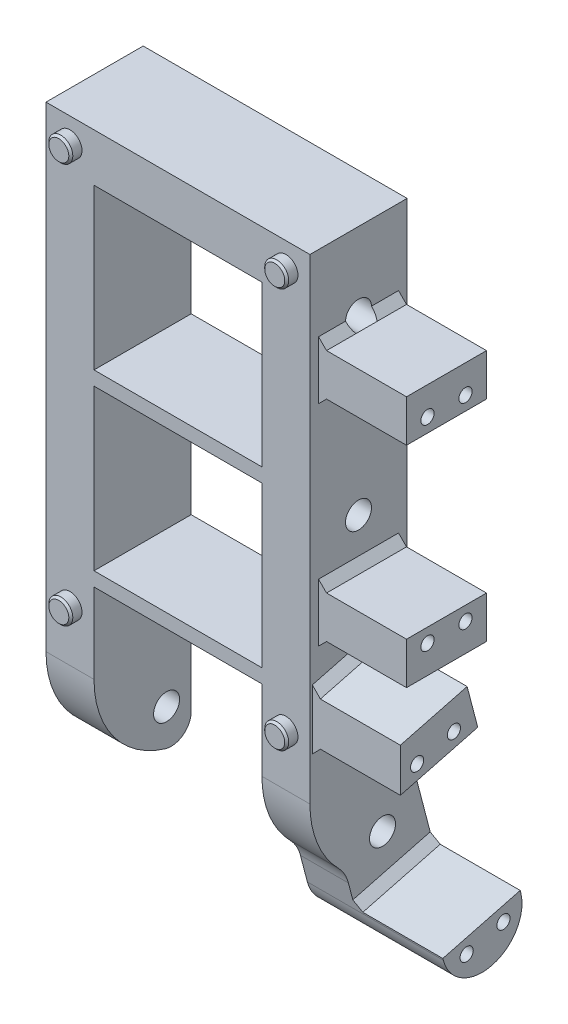
from build123d import *

# Parameters (mm, degrees)
SKETCH2_W               = 42
SKETCH2_H               = 40
BOSS_EXTRUDE1_DEPTH     = 12.15
CUT_EXTRUDE1_DEPTH      = 149.231651478
CUT_EXTRUDE1_DEPTH_BACK = 149.231651478
SKETCH3_R               = 3.25
FILLET1_R               = 25
FILLET2_R               = 5
SKETCH4_R               = 3
BOSS_EXTRUDE2_DEPTH     = 2.8
CHAMFER1_SIZE           = 0.5
SKETCH6_W               = 20
SKETCH6_H               = 10.5
BOSS_EXTRUDE3_DEPTH     = 22
BOSS_EXTRUDE5_DEPTH     = 12
SKETCH7_R               = 1.65
CUT_EXTRUDE2_DEPTH      = 4
FILLET3_R               = 10
CHAMFER3_SIZE           = 2
SKETCH9_R               = 3.25
CUT_EXTRUDE3_DEPTH      = 2


# Some blends are built 0.0001 mm under size
with BuildPart() as part:
    # Sketch2 → Boss-Extrude1 (new, symmetric)
    with BuildSketch(Plane.XY):
        Polygon((-33, 0), (33, 0), (33, -144), (21, -144), (21, -99), (-21, -99), (-21, -144), (-33, -144), align=None)
        with Locations((0, -32)):
            Rectangle(SKETCH2_W, SKETCH2_H, mode=Mode.SUBTRACT)
        with Locations((0, -75.5)):
            Rectangle(SKETCH2_W, SKETCH2_H, mode=Mode.SUBTRACT)
    extrude(amount=BOSS_EXTRUDE1_DEPTH, both=True)

    # Sketch3 → Cut-Extrude1 (cut, two sides: drawn at the far end of the back side and taken through both)
    with BuildSketch(Plane(origin=(0, 0, 0), x_dir=(0, 0, -1), z_dir=(1, 0, 0)).offset(-CUT_EXTRUDE1_DEPTH_BACK)):
        with Locations((0, -106)):
            Circle(SKETCH3_R)
        with Locations((0, -62.5)):
            Circle(SKETCH3_R)
        with Locations((0, -19)):
            Circle(SKETCH3_R)
        with Locations((6, -134)):
            Circle(SKETCH3_R)
    extrude(amount=CUT_EXTRUDE1_DEPTH + CUT_EXTRUDE1_DEPTH_BACK, mode=Mode.SUBTRACT)

    # Fillet1
    # the kernel refuses this fillet: 25 mm, written as the material it takes off along each edge
    with BuildSketch(Plane(origin=(95.475495196, -144, 12.15), x_dir=(0, 1, 0), z_dir=(-1, 0, 0)), Plane(origin=(41.475495196, -144, 12.15), x_dir=(0, 1, 0), z_dir=(-1, 0, 0))) as fillet1_piece_1:
        with BuildLine():
            CenterArc((24.990198078, 25), FILLET1_R, 181.604491527, 88.395508473)
            Line((0, 24.3), (-0.499803962, 24.286))
            ThreePointArc((-0.499803962, 24.286), (-0.5, 12.15), (-0.5, 0))
            Line((-0.5, 0), (0, -0.5))
            Line((0, -0.5), (24.990198078, -0.5))
            Line((24.990198078, -0.5), (24.990198078, 0))
        make_face()
    extrude(amount=136.950990392, mode=Mode.SUBTRACT)

    # Fillet2
    fillet2_edges = [part.edges().sort_by_distance(p)[0] for p in [
        (-27, -144, -12.15),
        (27, -144, -12.15),
    ]]
    fillet(fillet2_edges, radius=FILLET2_R)

    # Sketch4 → Boss-Extrude2 (add)
    with BuildSketch(Plane(origin=(0, 0, 12.15), x_dir=(-1, 0, 0), z_dir=(0, 0, -1))):
        with Locations((-27, -6)):
            Circle(SKETCH4_R)
        with Locations((27, -6)):
            Circle(SKETCH4_R)
        with Locations((27, -106)):
            Circle(SKETCH4_R)
        with Locations((-27, -106)):
            Circle(SKETCH4_R)
    extrude(amount=-BOSS_EXTRUDE2_DEPTH)

    # Chamfer1
    chamfer1_edges = [part.edges().sort_by_distance(p)[0] for p in [
        (30, -6, 14.95),
        (-24, -6, 14.95),
        (-24, -106, 14.95),
        (30, -106, 14.95),
    ]]
    chamfer(chamfer1_edges, length=CHAMFER1_SIZE)

    # Sketch6 → Boss-Extrude3 (add)
    with BuildSketch(Plane(origin=(55, 0, 0), x_dir=(0, 0, -1), z_dir=(1, 0, 0))):
        with Locations((0, -26.14)):
            Rectangle(SKETCH6_W, SKETCH6_H)
        with Locations((0, -78.64)):
            Rectangle(SKETCH6_W, SKETCH6_H)
        Polygon((-0.922937771, -147.063882754), (18.427721371, -142.00898505), (21.081542665, -152.168081099), (1.730883524, -157.222978804), align=None)
        Polygon((-11.538222949, -95.575155055), (5.158614897, -91.213504805), (7.812436192, -101.372600854), (-11.538222949, -106.427498558), align=None)
    extrude(amount=-BOSS_EXTRUDE3_DEPTH)


with BuildPart() as boss_extrude3_piece_1:
    # of the separate pieces the step leaves, piece 1, a body of its own (boss_extrude3_pieces)
    add(part.part.solids().sort_by_distance((24, -106, 14.45))[0])



with BuildPart() as boss_extrude3_piece_2:
    # of the separate pieces the step leaves, piece 2, a body of its own (boss_extrude3_pieces)
    add(part.part.solids().sort_by_distance((55, -147.063882754, 0.922937771))[0])


with BuildPart() as boss_extrude3_piece_1_1:
    add(boss_extrude3_piece_1.part)

    add(boss_extrude3_piece_2.part)  # Boss-Extrude5 merges Boss-Extrude3 piece 2
    # Sketch8 → Boss-Extrude5 (add)
    with BuildSketch(Plane(origin=(33, 0, 0), x_dir=(0, 0, -1), z_dir=(1, 0, 0))):
        with BuildLine():
            Line((-0.922937771, -147.063882754), (-3.256769685, -138.129738384))
            ThreePointArc((-3.256769685, -138.129738384), (0.984375203, -141.014504786), (5.725, -142.972989836))
            ThreePointArc((5.725, -142.972989836), (10.139565186, -142.188157138), (12.15, -138.180352253))
            Line((12.15, -138.180352253), (12.15, -117.977233364))
            Line((12.15, -117.977233364), (18.427721371, -142.00898505))
            Line((18.427721371, -142.00898505), (21.081542665, -152.168081099))
            Line((21.081542665, -152.168081099), (1.730883524, -157.222978804))
            Line((1.730883524, -157.222978804), (-0.922937771, -147.063882754))
        make_face()
    extrude(amount=-BOSS_EXTRUDE5_DEPTH)

    # Sketch7 → Cut-Extrude2 (cut)
    with BuildSketch(Plane(origin=(55, 0, 0), x_dir=(0, 0, -1), z_dir=(1, 0, 0))):
        with Locations((-4.75, -27.89)):
            Circle(SKETCH7_R)
        with Locations((4.75, -27.89)):
            Circle(SKETCH7_R)
        with Locations((-4.75, -76.89)):
            Circle(SKETCH7_R)
        with Locations((4.75, -76.89)):
            Circle(SKETCH7_R)
        with Locations((-7.343282023, -101.714222561)):
            Circle(SKETCH7_R)
        with Locations((1.848281069, -99.313146151)):
            Circle(SKETCH7_R)
        with Locations((5.041217352, -149.123337457)):
            Circle(SKETCH7_R)
        with Locations((14.232780444, -146.722261047)):
            Circle(SKETCH7_R)
    extrude(amount=-CUT_EXTRUDE2_DEPTH, mode=Mode.SUBTRACT)

    # Fillet3
    fillet3_edges = [boss_extrude3_piece_1_1.edges().sort_by_distance(p)[0] for p in [
        (38, -157.222978804, -1.730883524),
        (38, -152.168081099, -21.081542665),
        (27, -117.977233364, -12.15),
        (27, -138.129738384, 3.256769685),
    ]]
    fillet(fillet3_edges, radius=FILLET3_R - 0.0001)  # a hair under: the kernel refuses the full size

    # Chamfer3
    # the kernel refuses this chamfer: 2 mm, written as the material it adds along each edge
    with BuildSketch(Plane(origin=(33, -20.89, 2.499429517), x_dir=(-0.027495876610585647, 0.9996219169112968, 0), z_dir=(0, 0, -1))) as chamfer3_piece_1_section:
        Polygon((CHAMFER3_SIZE * 0.999621916911, CHAMFER3_SIZE * 0.0274958766106), (-CHAMFER3_SIZE * 0.0274958766106, CHAMFER3_SIZE * 0.999621916911), (0, 0), align=None)
    chamfer3_piece_1 = extrude(amount=12.499429517, mode=Mode.PRIVATE)
    chamfer3_piece_1 = chamfer3_piece_1 - Plane(origin=(33.672455273, -19, 0), x_dir=(0, 0, -1), z_dir=(-1, 0, 0)) * Cylinder(3.25, 33, mode=Mode.PRIVATE)
    add(chamfer3_piece_1)
    with BuildSketch(Plane(origin=(33, -20.89, 10), x_dir=(-0.027495876610585647, 0.9996219169112968, 0), z_dir=(0, 0, -1))) as chamfer3_piece_2_section:
        Polygon((CHAMFER3_SIZE * 0.999621916911, CHAMFER3_SIZE * 0.0274958766106), (-CHAMFER3_SIZE * 0.0274958766106, CHAMFER3_SIZE * 0.999621916911), (0, 0), align=None)
    chamfer3_piece_2 = extrude(amount=12.499429517, mode=Mode.PRIVATE)
    chamfer3_piece_2 = chamfer3_piece_2 - Plane(origin=(33.672455268, -19, 0), x_dir=(0, 0, -1), z_dir=(-1, 0, 0)) * Cylinder(3.25, 33, mode=Mode.PRIVATE)
    add(chamfer3_piece_2)
    with BuildSketch(Plane(origin=(33, -31.39, -10), x_dir=(-0.027495876610585647, -0.9996219169112968, 0), z_dir=(0, 0, 1)), Plane(origin=(33, -73.39, 10), x_dir=(-0.02749587661058555, 0.9996219169112968, 0), z_dir=(0, 0, -1)), Plane(origin=(33, -83.89, -10), x_dir=(-0.02749587661058555, -0.9996219169112968, 0), z_dir=(0, 0, 1)), Plane(origin=(33, -147.063882754, 0.922937771), x_dir=(-0.02749587661058553, 0.9671671492128019, 0.25264932664267514), z_dir=(0, 0.2527448852095291, -0.96753295706163))) as chamfer3_piece_3:
        Polygon((CHAMFER3_SIZE * 0.999621916911, CHAMFER3_SIZE * 0.0274958766106), (-CHAMFER3_SIZE * 0.0274958766106, CHAMFER3_SIZE * 0.999621916911), (0, 0), align=None)
    extrude(amount=20)
    with BuildSketch(Plane(origin=(33, -102.802754601, -2.337663147), x_dir=(-0.027495876610585706, -0.9671671492128018, -0.25264932664267636), z_dir=(0, -0.2527448852095303, 0.9675329570616298))) as chamfer3_piece_4_section:
        Polygon((CHAMFER3_SIZE * 0.999621916911, CHAMFER3_SIZE * 0.0274958766106), (-CHAMFER3_SIZE * 0.0274958766106, CHAMFER3_SIZE * 0.999621916911), (0, 0), align=None)
    chamfer3_piece_4 = extrude(amount=19.484878578, mode=Mode.PRIVATE)
    chamfer3_piece_4 = chamfer3_piece_4 - Plane(origin=(33.819409297, -106, 0), x_dir=(0, 0, -1), z_dir=(-1, 0, 0)) * Cylinder(3.25, 47, mode=Mode.PRIVATE)
    chamfer3_piece_4 = split(chamfer3_piece_4, bisect_by=Plane(origin=(33.819409297, -103.234814786, 11.538222949), z_dir=(0, 0, -1)), keep=Keep.TOP, mode=Mode.PRIVATE)
    add(chamfer3_piece_4)
    with BuildSketch(Plane(origin=(33, -96.875114499, 16.514599041), x_dir=(-0.027495876610585716, 0.967167149212802, 0.2526493266426752), z_dir=(0, 0.2527448852095292, -0.96753295706163))) as chamfer3_piece_5_section:
        Polygon((CHAMFER3_SIZE * 0.999621916911, CHAMFER3_SIZE * 0.0274958766106), (-CHAMFER3_SIZE * 0.0274958766106, CHAMFER3_SIZE * 0.999621916911), (0, 0), align=None)
    chamfer3_piece_5 = extrude(amount=22.400491663, mode=Mode.PRIVATE)
    chamfer3_piece_5 = split(chamfer3_piece_5, bisect_by=Plane(origin=(33.668365734, -92.730700089, 11.538222949), z_dir=(0, 0, -1)), keep=Keep.TOP, mode=Mode.PRIVATE)
    add(chamfer3_piece_5)
    with BuildSketch(Plane(origin=(33, -101.372600854, -7.812436192), x_dir=(-0.027495876610585706, -0.9671671492128017, -0.25264932664267636), z_dir=(0, -0.2527448852095303, 0.9675329570616298))) as chamfer3_piece_6_section:
        Polygon((CHAMFER3_SIZE * 0.999621916911, CHAMFER3_SIZE * 0.0274958766106), (-CHAMFER3_SIZE * 0.0274958766106, CHAMFER3_SIZE * 0.999621916911), (0, 0), align=None)
    chamfer3_piece_6 = extrude(amount=11.798194515, mode=Mode.PRIVATE)
    chamfer3_piece_6 = chamfer3_piece_6 - Plane(origin=(33.67836444, -106, 0), x_dir=(0, 0, -1), z_dir=(-1, 0, 0)) * Cylinder(3.25, 32, mode=Mode.PRIVATE)
    add(chamfer3_piece_6)

    # Sketch9 → Cut-Extrude3 (cut)
    with BuildSketch(Plane(origin=(33, 0, 0), x_dir=(0, 0, -1), z_dir=(1, 0, 0))):
        with Locations((0, -19)):
            Circle(SKETCH9_R)
        with Locations((0, -106)):
            Circle(SKETCH9_R)
    extrude(amount=CUT_EXTRUDE3_DEPTH, mode=Mode.SUBTRACT)


solid = boss_extrude3_piece_1_1.part
